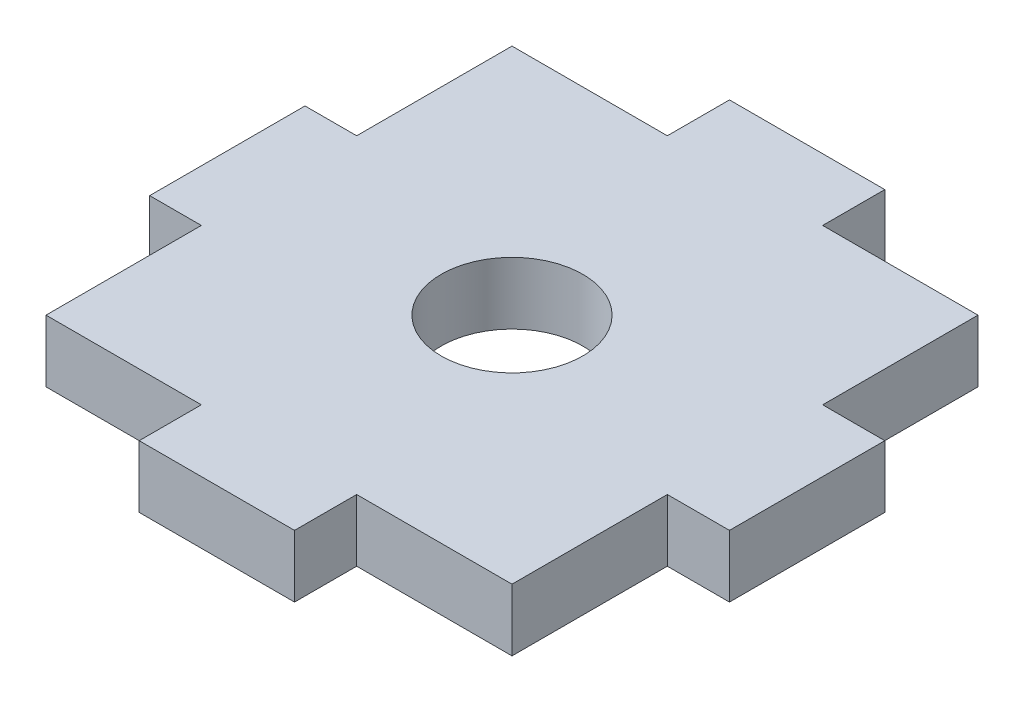
from build123d import *

# Parameters (mm, degrees)
SKETCH1_R           = 4.557723878
BOSS_EXTRUDE1_DEPTH = 4


with BuildPart() as part:
    # Sketch1 → Boss-Extrude1 (new body)
    with BuildSketch(Plane(origin=(0, 0, 0), x_dir=(1, 0, 0), z_dir=(0, 1, 0))):
        Polygon((-28.38315405, -37.007955545), (-28.38315405, -41.007955545), (-18.38315405, -41.007955545), (-18.38315405, -37.007955545), (-8.38315405, -37.007955545), (-8.38315405, -27.007955545), (-4.38315405, -27.007955545), (-4.38315405, -17.007955545), (-8.38315405, -17.007955545), (-8.38315405, -7.007955545), (-18.38315405, -7.007955545), (-18.38315405, -3.007955545), (-28.38315405, -3.007955545), (-28.38315405, -7.007955545), (-38.38315405, -7.007955545), (-38.38315405, -17.007955545), (-41.708687903, -17.007955545), (-41.708687903, -27.007955545), (-38.38315405, -27.007955545), (-38.38315405, -37.007955545), align=None)
        with Locations((-23.38315405, -22.007955545)):
            Circle(SKETCH1_R, mode=Mode.SUBTRACT)
    extrude(amount=BOSS_EXTRUDE1_DEPTH)


solid = part.part
